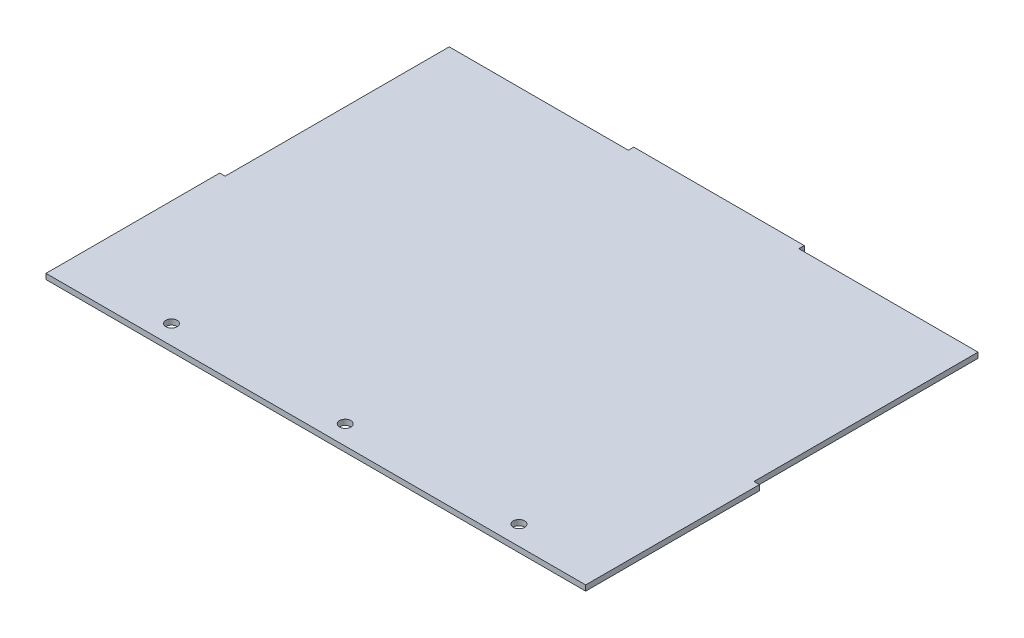
from build123d import *

# Parameters (mm, degrees)
SKETCH1_W           = 315.58
SKETCH1_H           = 3.175
BOSS_EXTRUDE1_DEPTH = 232.600000128
SKETCH5_W           = 3.175
SKETCH5_H           = 130.999992
CUT_EXTRUDE2_DEPTH  = 282.088108579
SKETCH7_R           = 3.302
CUT_EXTRUDE3_DEPTH  = 282.088108579
LPATTERN1_COUNT     = 3
LPATTERN1_PITCH     = 101.6
SKETCH8_W           = 99.68
SKETCH8_H           = 3.175
BOSS_EXTRUDE2_DEPTH = 3.175


with BuildPart() as part:
    # Sketch1 → Boss-Extrude1 (new body)
    with BuildSketch(Plane.XY):
        Rectangle(SKETCH1_W, SKETCH1_H)
    extrude(amount=BOSS_EXTRUDE1_DEPTH)

    # Sketch5 → Cut-Extrude2 (cut, symmetric)
    with BuildSketch(Plane(origin=(0, 1.5875, 0), x_dir=(1, 0, 0), z_dir=(0, 1, 0))):
        with Locations((-156.2025, -65.499996)):
            Rectangle(SKETCH5_W, SKETCH5_H)
    cut_extrude2 = extrude(amount=CUT_EXTRUDE2_DEPTH, both=True, mode=Mode.SUBTRACT)

    # Mirror1: Cut-Extrude2 across plane
    add(cut_extrude2.mirror(Plane(origin=(0, 0, 0), x_dir=(0, 0, 1), z_dir=(1, 0, 0))), mode=Mode.SUBTRACT)

    # Sketch7 → Cut-Extrude3 (cut, through all)
    with BuildSketch(Plane.XZ.offset(1.5875)):
        with Locations((107.495393219, 221.30835)):
            Circle(SKETCH7_R)
    cut_extrude3 = extrude(amount=-CUT_EXTRUDE3_DEPTH, mode=Mode.SUBTRACT)

    # LPattern1: Cut-Extrude3 ×3
    with Locations(*[(-i * LPATTERN1_PITCH, 0, 0) for i in range(1, LPATTERN1_COUNT)]):
        add(cut_extrude3, mode=Mode.SUBTRACT)

    # Sketch8 → Boss-Extrude2 (add)
    with BuildSketch(Plane(origin=(0, 0, 0), x_dir=(-1, 0, 0), z_dir=(0, 0, -1))):
        Rectangle(SKETCH8_W, SKETCH8_H)
    extrude(amount=BOSS_EXTRUDE2_DEPTH)


solid = part.part
